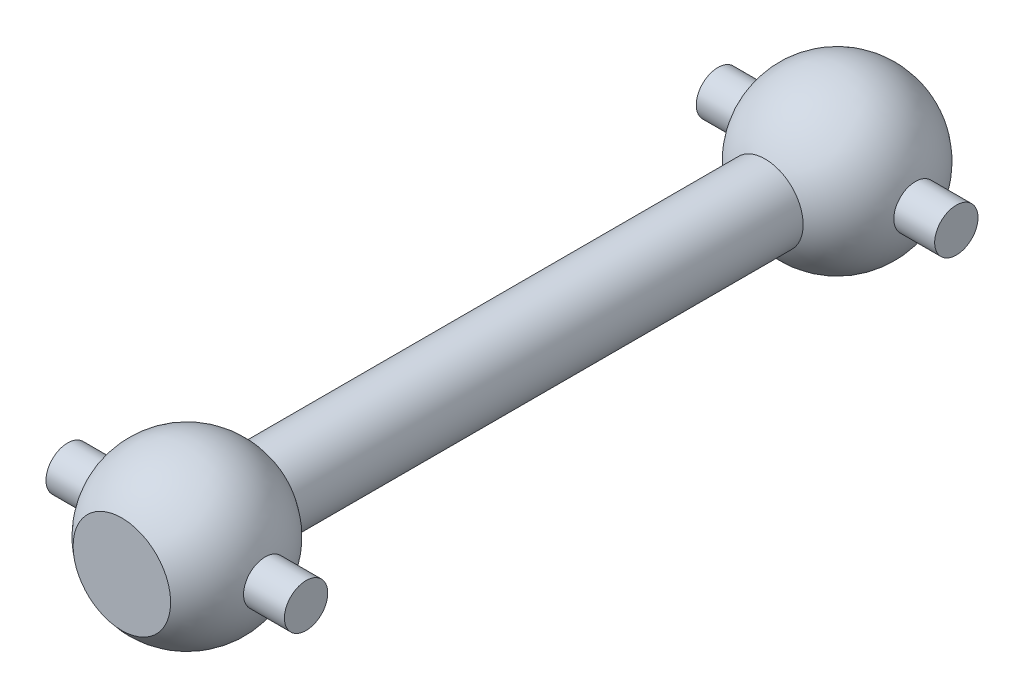
from build123d import *

# Parameters (mm, degrees)
SKETCH_1_R      = 3.5
EXTRUDE_1_DEPTH = 25
SKETCH_3_R      = 2
EXTRUDE_2_DEPTH = 11


with BuildPart() as part:
    # 草图1 → 凸台-拉伸1 (new, symmetric)
    with BuildSketch(Plane.XY):
        Circle(SKETCH_1_R)
    extrude(amount=EXTRUDE_1_DEPTH, both=True)

    # 草图2 → 旋转1 (revolve)
    with BuildSketch(Plane(origin=(0, 0, 0), x_dir=(0, 0, -1), z_dir=(1, 0, 0))):
        with BuildLine():
            Line((36, 0), (36, 4.5))
            ThreePointArc((36, 4.5), (27.628291755, 7.115124735), (22.5, 0))
            Line((22.5, 0), (36, 0))
        make_face()
    revolve_1 = revolve(axis=Axis((0, 0, -22.5), (0, 0, -1)))

    # 草图3 → 凸台-拉伸2 (add, symmetric)
    with BuildSketch(Plane(origin=(0, 0, 0), x_dir=(0, 0, -1), z_dir=(1, 0, 0))):
        with Locations((30, 0)):
            Circle(SKETCH_3_R)
    extrude_2 = extrude(amount=EXTRUDE_2_DEPTH, both=True)

    # 镜向1: 旋转1, 凸台-拉伸2 across plane
    add(revolve_1.mirror(Plane.XY))
    add(extrude_2.mirror(Plane.XY))


solid = part.part
